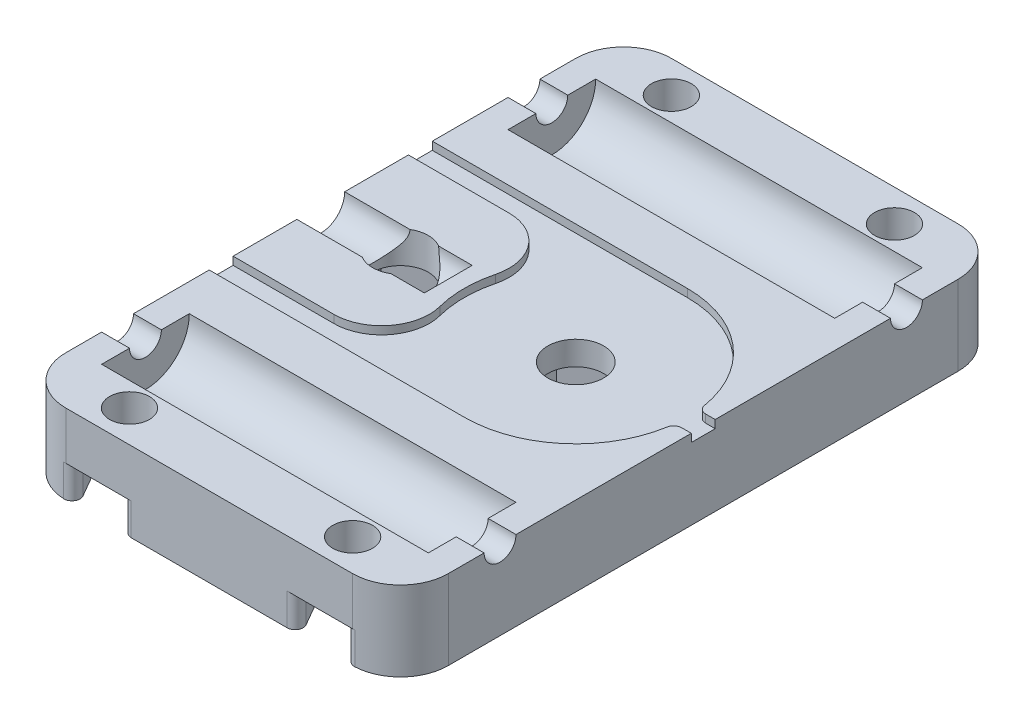
from build123d import *

# Parameters (mm, degrees)
SKETCH_1_W               = 24
SKETCH_1_H               = 38
EXTRUDE_1_DEPTH          = 5
SKETCH_2_R               = 2.75
CUT_EXTRUDE_1_DEPTH      = 10.25
CUT_EXTRUDE_2_DEPTH      = 24.021728866
CUT_EXTRUDE_2_DEPTH_BACK = 24.021728866
SKETCH_3_R               = 1
CUT_EXTRUDE_3_DEPTH      = 0.5
SKETCH_5_R               = 1.75
CUT_EXTRUDE_4_DEPTH      = 24.021728866
FILLET_1_R               = 3
FILLET_2_R               = 3
SKETCH_6_R               = 1.5
CUT_EXTRUDE_5_DEPTH      = 8
FILLET_3_R               = 0.5
SKETCH_7_R               = 1.25
CUT_EXTRUDE_6_DEPTH      = 24.02172894
CUT_EXTRUDE_9_DEPTH      = 3
CUT_EXTRUDE_10_DEPTH     = 2
FILLET_4_R               = 0.5


with BuildPart() as part:
    # Эскиз1 → Бобышка-Вытянуть1 (new body)
    with BuildSketch(Plane(origin=(0, 0, 0), x_dir=(1, 0, 0), z_dir=(0, 1, 0))):
        Rectangle(SKETCH_1_W, SKETCH_1_H)
    extrude(amount=EXTRUDE_1_DEPTH)

    # Эскиз2 → Вырез-Вытянуть1 (cut, symmetric)
    with BuildSketch(Plane(origin=(0, 0, 0), x_dir=(0, 0, -1), z_dir=(1, 0, 0))):
        with Locations((-12.75, 5)):
            Circle(SKETCH_2_R)
        with Locations((12.75, 5)):
            Circle(SKETCH_2_R)
    extrude(amount=CUT_EXTRUDE_1_DEPTH, both=True, mode=Mode.SUBTRACT)

    # Эскиз3 → Вырез-Вытянуть2 (cut, two sides: drawn at the far end of the back side and taken through both)
    with BuildSketch(Plane(origin=(0, 0, 0), x_dir=(0, 0, -1), z_dir=(1, 0, 0)).offset(-CUT_EXTRUDE_2_DEPTH_BACK)):
        with Locations((-12.75, 5)):
            Circle(SKETCH_3_R)
        with Locations((12.75, 5)):
            Circle(SKETCH_3_R)
    extrude(amount=CUT_EXTRUDE_2_DEPTH + CUT_EXTRUDE_2_DEPTH_BACK, mode=Mode.SUBTRACT)

    # Эскиз4 → Вырез-Вытянуть3 (cut)
    with BuildSketch(Plane(origin=(0, 5, 0), x_dir=(1, 0, 0), z_dir=(0, 1, 0))):
        with BuildLine():
            Line((4, 7), (-12, 7))
            Line((-12, 7), (-12, 5.5))
            Line((-12, 5.5), (-0.330127019, 5.5))
            ThreePointArc((-0.330127019, 5.5), (-3, 0), (-0.330127019, -5.5))
            Line((-0.330127019, -5.5), (-12, -5.5))
            Line((-12, -5.5), (-12, -7))
            Line((-12, -7), (4, -7))
            ThreePointArc((4, -7), (8.677071733, -5.208166664), (10.959705454, -0.75))
            Line((10.959705454, -0.75), (12, -0.75))
            Line((12, -0.75), (12, 0.75))
            Line((12, 0.75), (10.959705454, 0.75))
            ThreePointArc((10.959705454, 0.75), (8.677071733, 5.208166664), (4, 7))
        make_face()
    extrude(amount=-CUT_EXTRUDE_3_DEPTH, mode=Mode.SUBTRACT)

    # Эскиз5 → Вырез-Вытянуть4 (cut, through all)
    with BuildSketch(Plane(origin=(0, 5, 0), x_dir=(1, 0, 0), z_dir=(0, 1, 0))):
        with Locations(Location((4, 0, 0), (0, 0, 270))):
            Circle(SKETCH_5_R)
        with Locations(Location((-7, 0, 0), (0, 0, 270))):
            Circle(SKETCH_5_R)
    extrude(amount=-CUT_EXTRUDE_4_DEPTH, mode=Mode.SUBTRACT)

    # Скругление1
    fillet_1_edges = [part.edges().sort_by_distance(p)[0] for p in [
        (-0.330127019, 4.75, 5.5),
        (-0.330127019, 4.75, -5.5),
    ]]
    fillet(fillet_1_edges, radius=FILLET_1_R)

    # Скругление2
    fillet_2_edges = [part.edges().sort_by_distance(p)[0] for p in [
        (12, 2.5, 19),
        (-12, 2.5, 19),
        (-12, 2.5, -19),
        (12, 2.5, -19),
    ]]
    fillet(fillet_2_edges, radius=FILLET_2_R)

    # Эскиз6 → Вырез-Вытянуть5 (cut)
    with BuildSketch(Plane.ZY.offset(12)):
        with Locations((0, 5)):
            Circle(SKETCH_6_R)
    extrude(amount=-CUT_EXTRUDE_5_DEPTH, mode=Mode.SUBTRACT)

    # Скругление3
    fillet_3_edges = [part.edges().sort_by_distance(p)[0] for p in [
        (10.959705454, 4.75, -0.75),
        (10.959705454, 4.75, 0.75),
    ]]
    fillet(fillet_3_edges, radius=FILLET_3_R)

    # Эскиз7 → Вырез-Вытянуть6 (cut, through all)
    with BuildSketch(Plane(origin=(0, 5, 0), x_dir=(1, 0, 0), z_dir=(0, 1, 0))):
        with Locations(Location((-7, 17, 0), (0, 0, 270))):
            Circle(SKETCH_7_R)
        with Locations(Location((7, 17, 0), (0, 0, 270))):
            Circle(SKETCH_7_R)
        with Locations(Location((7, -17, 0), (0, 0, 270))):
            Circle(SKETCH_7_R)
        with Locations(Location((-7, -17, 0), (0, 0, 270))):
            Circle(SKETCH_7_R)
    extrude(amount=-CUT_EXTRUDE_6_DEPTH, mode=Mode.SUBTRACT)

    # Эскиз9 → Вырез-Вытянуть9 (cut)
    with BuildSketch(Plane.XZ):
        Polygon((-7, 3.290896534), (-9.85, 1.645448267), (-9.85, -1.645448267), (-7, -3.290896534), (-4.15, -1.645448267), (-4.15, 1.645448267), align=None)
        Polygon((6.85, -1.645448267), (6.85, 1.645448267), (4, 3.290896534), (1.15, 1.645448267), (1.15, -1.645448267), (4, -3.290896534), align=None)
    extrude(amount=-CUT_EXTRUDE_9_DEPTH, mode=Mode.SUBTRACT)

    # Эскиз10 → Вырез-Вытянуть10 (cut)
    with BuildSketch(Plane.XZ):
        Polygon((8.198001809, 14.925), (5.801998191, 14.925), (4.603996383, 17), (5.801998191, 19.075), (8.198001809, 19.075), (9.396003617, 17), align=None)
        Polygon((-5.801998191, 14.925), (-4.603996383, 17), (-5.801998191, 19.075), (-8.198001809, 19.075), (-9.396003617, 17), (-8.198001809, 14.925), align=None)
        Polygon((9.396003617, -17), (8.198001809, -14.925), (5.801998191, -14.925), (4.603996383, -17), (5.801998191, -19.075), (8.198001809, -19.075), align=None)
        Polygon((-8.198001809, -14.925), (-5.801998191, -14.925), (-4.603996383, -17), (-5.801998191, -19.075), (-8.198001809, -19.075), (-9.396003617, -17), align=None)
    extrude(amount=-CUT_EXTRUDE_10_DEPTH, mode=Mode.SUBTRACT)

    # Скругление4
    # the kernel refuses this fillet: 0.5 mm, written as the material it takes off along each edge
    with BuildSketch(Plane(origin=(-8.241303079, 2, 19), x_dir=(-0.9999949104209014, 0, -0.003190475245701581), z_dir=(0, -1, 0)), Plane(origin=(8.241303079, 2, -19), x_dir=(0.9999949104209014, 0, 0.003190475245705545), z_dir=(0, -1, 0))) as fillet_4_piece_1:
        with BuildLine():
            CenterArc((0.868988605, 0.499594021), FILLET_4_R, 149.817198924, 122.491852834)
            Line((0.436775726, 0.750974265), (0.393554438, 0.77611229))
            Line((0.393554438, 0.77611229), (-0.043221288, 0.025138024))
            Line((-0.043221288, 0.025138024), (-0.000159524, -0.049999746))
            ThreePointArc((-0.000159524, -0.049999746), (0.758533536, -0.052420349), (0.891147911, -0.049959402))
            Line((0.891147911, -0.049959402), (0.889133429, 0))
        make_face()
    extrude(amount=4.222833572, mode=Mode.SUBTRACT)
    with BuildSketch(Plane(origin=(-5.758696921, -2.165063509, 19), x_dir=(1, 0, 0), z_dir=(0, 1, 0)), Plane(origin=(5.758696921, -2.165063509, -19), x_dir=(-1, 0, 0), z_dir=(0, 1, 0))) as fillet_4_piece_2:
        with BuildLine():
            CenterArc((FILLET_4_R * 1.73205080757, FILLET_4_R), FILLET_4_R, 150, 120)
            Line((FILLET_4_R * 0.866025403784, FILLET_4_R * 1.5), (0, 0))
            Line((0, 0), (FILLET_4_R * 1.73205080757, 0))
        make_face()
    extrude(amount=4.165063509, mode=Mode.SUBTRACT)
    with BuildSketch(Plane(origin=(-5.758696921, -2.165063509, -19), x_dir=(1, 0, 0), z_dir=(0, 1, 0)), Plane(origin=(5.758696921, -2.165063509, 19), x_dir=(-1, 0, 0), z_dir=(0, 1, 0))) as fillet_4_piece_3:
        with BuildLine():
            CenterArc((FILLET_4_R * 1.73205080757, -FILLET_4_R), FILLET_4_R, 90, 120)
            Line((FILLET_4_R * 0.866025403784, -FILLET_4_R * 1.5), (0, 0))
            Line((0, 0), (FILLET_4_R * 1.73205080757, 0))
        make_face()
    extrude(amount=4.165063509, mode=Mode.SUBTRACT)
    with BuildSketch(Plane(origin=(-8.241303079, 2, -19), x_dir=(-0.9999949104209014, 0, 0.0031904752457015684), z_dir=(0, -1, 0)), Plane(origin=(8.241303079, 2, 19), x_dir=(0.9999949104209014, 0, -0.003190475245701575), z_dir=(0, -1, 0))) as fillet_4_piece_4:
        with BuildLine():
            CenterArc((0.868988605, -0.499594021), FILLET_4_R, 87.690948243, 122.491852834)
            Line((0.436775726, -0.750974265), (0.393554438, -0.77611229))
            Line((0.393554438, -0.77611229), (-0.043221288, -0.025138024))
            Line((-0.043221288, -0.025138024), (-0.000159524, 0.049999746))
            ThreePointArc((-0.000159524, 0.049999746), (0.758533536, 0.052420349), (0.891147911, 0.049959402))
            Line((0.891147911, 0.049959402), (0.889133429, 0))
        make_face()
    extrude(amount=4.222833572, mode=Mode.SUBTRACT)


solid = part.part
